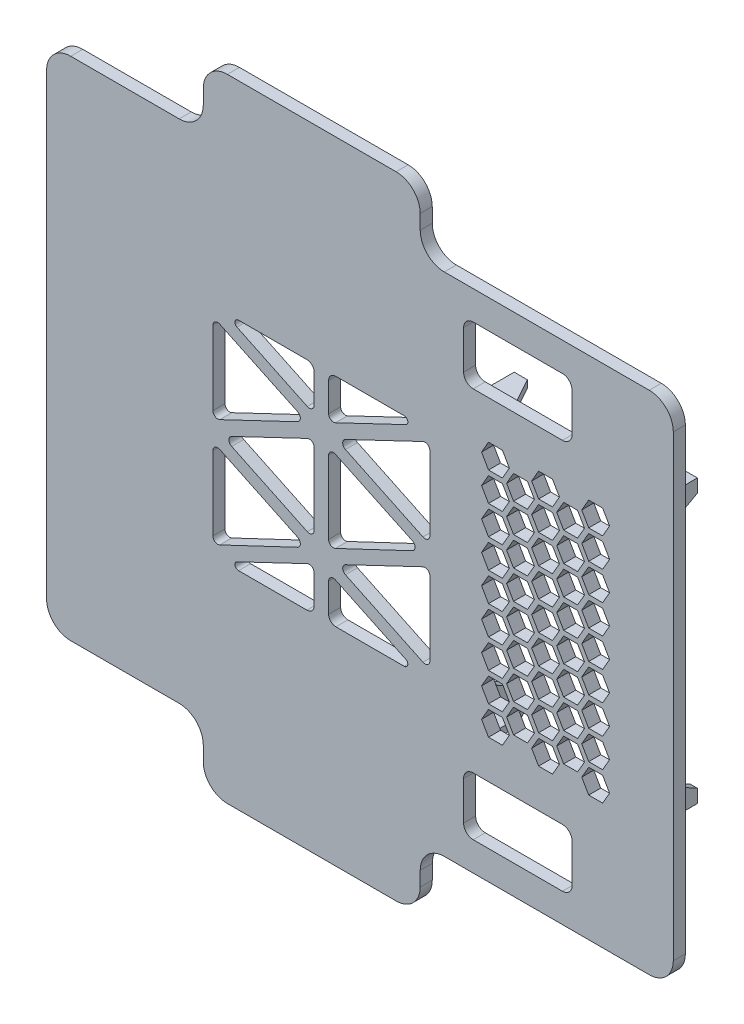
from build123d import *

# Parameters (mm, degrees)
EXTRUDE_1_DEPTH       = 5
EXTRUDE_2_DEPTH       = 20
CUT_EXTRUDE_3_DEPTH   = 10
CUT_EXTRUDE_4_DEPTH   = 10
MIRROR_2_COPY_1_DEPTH = 20
MIRROR_2_COPY_2_DEPTH = 10
MIRROR_2_COPY_3_DEPTH = 10
MIRROR_2_COPY_4_DEPTH = 20
MIRROR_2_COPY_5_DEPTH = 10
MIRROR_2_COPY_6_DEPTH = 10
CUT_EXTRUDE_5_DEPTH   = 5
SKETCH_9_W            = 45
SKETCH_9_H            = 24
CUT_EXTRUDE_6_DEPTH   = 5
FILLET_1_R            = 4
FILLET_2_R            = 1.5
FILLET_3_R            = 2
FILLET_4_R            = 3


with BuildPart() as part:
    # 草图1 → 凸台-拉伸1 (new body)
    with BuildSketch(Plane.XY):
        with BuildLine():
            Line((-130, 95), (-130, -95))
            ThreePointArc((-130, -95), (-127.071067812, -102.071067812), (-120, -105))
            Line((-120, -105), (-75, -105))
            ThreePointArc((-75, -105), (-67.928932188, -107.928932188), (-65, -115))
            Line((-65, -115), (-65, -121))
            ThreePointArc((-65, -121), (-62.071067812, -128.071067812), (-55, -131))
            Line((-55, -131), (15, -131))
            ThreePointArc((15, -131), (22.071067812, -128.071067812), (25, -121))
            Line((25, -121), (25, -115))
            ThreePointArc((25, -115), (27.928932188, -107.928932188), (35, -105))
            Line((35, -105), (120, -105))
            ThreePointArc((120, -105), (127.071067812, -102.071067812), (130, -95))
            Line((130, -95), (130, 95))
            ThreePointArc((130, 95), (127.071067812, 102.071067812), (120, 105))
            Line((120, 105), (35, 105))
            ThreePointArc((35, 105), (27.928932188, 107.928932188), (25, 115))
            Line((25, 115), (25, 121))
            ThreePointArc((25, 121), (22.071067812, 128.071067812), (15, 131))
            Line((15, 131), (-55, 131))
            ThreePointArc((-55, 131), (-62.071067812, 128.071067812), (-65, 121))
            Line((-65, 121), (-65, 115))
            ThreePointArc((-65, 115), (-67.928932188, 107.928932188), (-75, 105))
            Line((-75, 105), (-120, 105))
            ThreePointArc((-120, 105), (-127.071067812, 102.071067812), (-130, 95))
        make_face()
    extrude(amount=EXTRUDE_1_DEPTH)

    # 草图4 → 凸台-拉伸2 (add)
    with BuildSketch(Plane(origin=(0, 0, 0), x_dir=(-1, 0, 0), z_dir=(0, 0, -1))):
        Polygon((-39, -47.5), (-39, -58.5), (-50, -58.5), (-50, -55.5), (-42, -55.5), (-42, -47.5), align=None)
    extrude_2 = extrude(amount=EXTRUDE_2_DEPTH)

    # 草图5 → 切除-拉伸3 (cut)
    with BuildSketch(Plane.XZ.offset(58.5)):
        Polygon((50, -10), (44.5, -20), (50, -20), align=None)
    cut_extrude_3 = extrude(amount=-CUT_EXTRUDE_3_DEPTH, mode=Mode.SUBTRACT)

    # 草图6 → 切除-拉伸4 (cut)
    with BuildSketch(Plane.ZY.offset(-39)):
        Polygon((-20, -53), (-10, -47.5), (-20, -47.5), align=None)
    cut_extrude_4 = extrude(amount=-CUT_EXTRUDE_4_DEPTH, mode=Mode.SUBTRACT)

    # 镜向1: 凸台-拉伸2, 切除-拉伸3, 切除-拉伸4 across plane
    add(extrude_2.mirror(Plane(origin=(77, 0, 0), x_dir=(0, 0, 1), z_dir=(1, 0, 0))))
    add(cut_extrude_3.mirror(Plane(origin=(77, 0, 0), x_dir=(0, 0, 1), z_dir=(1, 0, 0))), mode=Mode.SUBTRACT)
    add(cut_extrude_4.mirror(Plane(origin=(77, 0, 0), x_dir=(0, 0, 1), z_dir=(1, 0, 0))), mode=Mode.SUBTRACT)

    # 镜向2 copy 1 sketch → 镜向2 copy 1 (add)
    with BuildSketch(Plane(origin=(154, 0, 0), x_dir=(1, 0, 0), z_dir=(0, 0, -1))):
        Polygon((-39, -47.5), (-39, -58.5), (-50, -58.5), (-50, -55.5), (-42, -55.5), (-42, -47.5), align=None)
    extrude(amount=MIRROR_2_COPY_1_DEPTH)

    # 镜向2 copy 2 sketch → 镜向2 copy 2 (cut)
    with BuildSketch(Plane(origin=(154, 58.5, 0), x_dir=(-1, 0, 0), z_dir=(0, 1, 0))):
        Polygon((50, -10), (44.5, -20), (50, -20), align=None)
    extrude(amount=-MIRROR_2_COPY_2_DEPTH, mode=Mode.SUBTRACT)

    # 镜向2 copy 3 sketch → 镜向2 copy 3 (cut)
    with BuildSketch(Plane(origin=(115, 0, 0), x_dir=(0, 0, 1), z_dir=(1, 0, 0))):
        Polygon((-20, -53), (-10, -47.5), (-20, -47.5), align=None)
    extrude(amount=-MIRROR_2_COPY_3_DEPTH, mode=Mode.SUBTRACT)

    # 镜向2 copy 4 sketch → 镜向2 copy 4 (add)
    with BuildSketch(Plane(origin=(0, 0, 0), x_dir=(-1, 0, 0), z_dir=(0, 0, -1))):
        Polygon((-39, 47.5), (-39, 58.5), (-50, 58.5), (-50, 55.5), (-42, 55.5), (-42, 47.5), align=None)
    extrude(amount=MIRROR_2_COPY_4_DEPTH)

    # 镜向2 copy 5 sketch → 镜向2 copy 5 (cut)
    with BuildSketch(Plane(origin=(0, 58.5, 0), x_dir=(1, 0, 0), z_dir=(0, 1, 0))):
        Polygon((50, 10), (44.5, 20), (50, 20), align=None)
    extrude(amount=-MIRROR_2_COPY_5_DEPTH, mode=Mode.SUBTRACT)

    # 镜向2 copy 6 sketch → 镜向2 copy 6 (cut)
    with BuildSketch(Plane.ZY.offset(-39)):
        Polygon((-20, 53), (-10, 47.5), (-20, 47.5), align=None)
    extrude(amount=-MIRROR_2_COPY_6_DEPTH, mode=Mode.SUBTRACT)

    # 草图7 → 切除-拉伸5 (cut)
    with BuildSketch(Plane(origin=(0, 0, 0), x_dir=(-1, 0, 0), z_dir=(0, 0, -1))):
        Polygon((-92.012994616, 36), (-94.899745962, 41), (-100.673248654, 41), (-103.56, 36), (-100.673248654, 31), (-94.899745962, 31), align=None)
        Polygon((-74.115136271, 31), (-71.228384925, 36), (-74.115136271, 41), (-79.888638963, 41), (-82.775390309, 36), (-79.888638963, 31), align=None)
        Polygon((-92.012994616, 24), (-94.899745962, 29), (-100.673248654, 29), (-103.56, 24), (-100.673248654, 19), (-94.899745962, 19), align=None)
        Polygon((-93.167695155, 30), (-90.280943809, 25), (-84.507441117, 25), (-81.620689771, 30), (-84.507441117, 35), (-90.280943809, 35), align=None)
        Polygon((-84.507441117, 37), (-81.620689771, 42), (-84.507441117, 47), (-90.280943809, 47), (-93.167695155, 42), (-90.280943809, 37), align=None)
        Polygon((-79.888638963, 43), (-74.115136271, 43), (-71.228384925, 48), (-74.115136271, 53), (-79.888638963, 53), (-82.775390309, 48), align=None)
        Polygon((-94.899745962, 43), (-92.012994616, 48), (-94.899745962, 53), (-100.673248654, 53), (-103.56, 48), (-100.673248654, 43), align=None)
        Polygon((-72.383085464, 42), (-69.496334118, 37), (-63.722831426, 37), (-60.83608008, 42), (-63.722831426, 47), (-69.496334118, 47), align=None)
        Polygon((-93.167695155, 18), (-90.280943809, 13), (-84.507441117, 13), (-81.620689771, 18), (-84.507441117, 23), (-90.280943809, 23), align=None)
        Polygon((-74.115136271, 19), (-71.228384925, 24), (-74.115136271, 29), (-79.888638963, 29), (-82.775390309, 24), (-79.888638963, 19), align=None)
        Polygon((-72.383085464, 30), (-69.496334118, 25), (-63.722831426, 25), (-60.83608008, 30), (-63.722831426, 35), (-69.496334118, 35), align=None)
        Polygon((-92.012994616, 12), (-94.899745962, 17), (-100.673248654, 17), (-103.56, 12), (-100.673248654, 7), (-94.899745962, 7), align=None)
        Polygon((-93.167695155, 6), (-90.280943809, 1), (-84.507441117, 1), (-81.620689771, 6), (-84.507441117, 11), (-90.280943809, 11), align=None)
        Polygon((-74.115136271, 7), (-71.228384925, 12), (-74.115136271, 17), (-79.888638963, 17), (-82.775390309, 12), (-79.888638963, 7), align=None)
        Polygon((-72.383085464, 18), (-69.496334118, 13), (-63.722831426, 13), (-60.83608008, 18), (-63.722831426, 23), (-69.496334118, 23), align=None)
        Polygon((-92.012994616, 0), (-94.899745962, 5), (-100.673248654, 5), (-103.56, 0), (-100.673248654, -5), (-94.899745962, -5), align=None)
        Polygon((-93.167695155, -6), (-90.280943809, -11), (-84.507441117, -11), (-81.620689771, -6), (-84.507441117, -1), (-90.280943809, -1), align=None)
        Polygon((-74.115136271, -5), (-71.228384925, 0), (-74.115136271, 5), (-79.888638963, 5), (-82.775390309, 0), (-79.888638963, -5), align=None)
        Polygon((-72.383085464, 6), (-69.496334118, 1), (-63.722831426, 1), (-60.83608008, 6), (-63.722831426, 11), (-69.496334118, 11), align=None)
        Polygon((-92.012994616, -12), (-94.899745962, -7), (-100.673248654, -7), (-103.56, -12), (-100.673248654, -17), (-94.899745962, -17), align=None)
        Polygon((-93.167695155, -18), (-90.280943809, -23), (-84.507441117, -23), (-81.620689771, -18), (-84.507441117, -13), (-90.280943809, -13), align=None)
        Polygon((-74.115136271, -17), (-71.228384925, -12), (-74.115136271, -7), (-79.888638963, -7), (-82.775390309, -12), (-79.888638963, -17), align=None)
        Polygon((-72.383085464, -6), (-69.496334118, -11), (-63.722831426, -11), (-60.83608008, -6), (-63.722831426, -1), (-69.496334118, -1), align=None)
        Polygon((-92.012994616, -24), (-94.899745962, -19), (-100.673248654, -19), (-103.56, -24), (-100.673248654, -29), (-94.899745962, -29), align=None)
        Polygon((-93.167695155, -30), (-90.280943809, -35), (-84.507441117, -35), (-81.620689771, -30), (-84.507441117, -25), (-90.280943809, -25), align=None)
        Polygon((-74.115136271, -29), (-71.228384925, -24), (-74.115136271, -19), (-79.888638963, -19), (-82.775390309, -24), (-79.888638963, -29), align=None)
        Polygon((-72.383085464, -18), (-69.496334118, -23), (-63.722831426, -23), (-60.83608008, -18), (-63.722831426, -13), (-69.496334118, -13), align=None)
        Polygon((-92.012994616, -36), (-94.899745962, -31), (-100.673248654, -31), (-103.56, -36), (-100.673248654, -41), (-94.899745962, -41), align=None)
        Polygon((-93.167695155, -42), (-90.280943809, -47), (-84.507441117, -47), (-81.620689771, -42), (-84.507441117, -37), (-90.280943809, -37), align=None)
        Polygon((-74.115136271, -41), (-71.228384925, -36), (-74.115136271, -31), (-79.888638963, -31), (-82.775390309, -36), (-79.888638963, -41), align=None)
        Polygon((-72.383085464, -30), (-69.496334118, -35), (-63.722831426, -35), (-60.83608008, -30), (-63.722831426, -25), (-69.496334118, -25), align=None)
        Polygon((-92.012994616, -48), (-94.899745962, -43), (-100.673248654, -43), (-103.56, -48), (-100.673248654, -53), (-94.899745962, -53), align=None)
        Polygon((-74.115136271, -53), (-71.228384925, -48), (-74.115136271, -43), (-79.888638963, -43), (-82.775390309, -48), (-79.888638963, -53), align=None)
        Polygon((-72.383085464, -42), (-69.496334118, -47), (-63.722831426, -47), (-60.83608008, -42), (-63.722831426, -37), (-69.496334118, -37), align=None)
        Polygon((-61.990780618, 36), (-59.104029272, 31), (-53.330526581, 31), (-50.443775235, 36), (-53.330526581, 41), (-59.104029272, 41), align=None)
        Polygon((-61.990780618, 48), (-59.104029272, 43), (-53.330526581, 43), (-50.443775235, 48), (-53.330526581, 53), (-59.104029272, 53), align=None)
        Polygon((-61.990780618, 24), (-59.104029272, 19), (-53.330526581, 19), (-50.443775235, 24), (-53.330526581, 29), (-59.104029272, 29), align=None)
        Polygon((-61.990780618, 12), (-59.104029272, 7), (-53.330526581, 7), (-50.443775235, 12), (-53.330526581, 17), (-59.104029272, 17), align=None)
        Polygon((-61.990780618, 0), (-59.104029272, -5), (-53.330526581, -5), (-50.443775235, 0), (-53.330526581, 5), (-59.104029272, 5), align=None)
        Polygon((-61.990780618, -12), (-59.104029272, -17), (-53.330526581, -17), (-50.443775235, -12), (-53.330526581, -7), (-59.104029272, -7), align=None)
        Polygon((-61.990780618, -24), (-59.104029272, -29), (-53.330526581, -29), (-50.443775235, -24), (-53.330526581, -19), (-59.104029272, -19), align=None)
        Polygon((-61.990780618, -36), (-59.104029272, -41), (-53.330526581, -41), (-50.443775235, -36), (-53.330526581, -31), (-59.104029272, -31), align=None)
        Polygon((-61.990780618, -48), (-59.104029272, -53), (-53.330526581, -53), (-50.443775235, -48), (-53.330526581, -43), (-59.104029272, -43), align=None)
    extrude(amount=-CUT_EXTRUDE_5_DEPTH, mode=Mode.SUBTRACT)

    # 草图9 → 切除-拉伸6 (cut)
    with BuildSketch(Plane(origin=(0, 0, 0), x_dir=(-1, 0, 0), z_dir=(0, 0, -1))):
        Polygon((9.804878049, 22.5), (-29, 41), (-29, 4), align=None)
        Polygon((13, -26.88372093), (-25, -45), (13, -45), align=None)
        Polygon((22.074593576, -22.557461202), (61, -41), (61, -4), align=None)
        Polygon((19, 26.88372093), (57, 45), (19, 45), align=None)
        Polygon((19, -18.11627907), (57, 0), (19, 18.11627907), align=None)
        with Locations((-65.5, 81)):
            Rectangle(SKETCH_9_W, SKETCH_9_H)
        with Locations((-65.5, -81)):
            Rectangle(SKETCH_9_W, SKETCH_9_H)
        Polygon((13, 45), (-25, 45), (13, 26.88372093), align=None)
        Polygon((61, 4), (61, 41), (22.074593576, 22.557461202), align=None)
        Polygon((13, 18.257993079), (-25.535898385, 0), (13, -18.257993079), align=None)
        Polygon((19, -45), (57, -45), (19, -26.88372093), align=None)
        Polygon((-29, -41), (9.804878049, -22.5), (-29, -4), align=None)
    extrude(amount=-CUT_EXTRUDE_6_DEPTH, mode=Mode.SUBTRACT)

    # 圆角1
    fillet_1_edges = [part.edges().sort_by_distance(p)[0] for p in [
        (43, -93, 2.5),
        (88, -69, 2.5),
        (43, -69, 2.5),
        (88, -93, 2.5),
        (88, 69, 2.5),
        (43, 69, 2.5),
        (43, 93, 2.5),
        (88, 93, 2.5),
    ]]
    fillet(fillet_1_edges, radius=FILLET_1_R)

    # 圆角2
    fillet_2_edges = [part.edges().sort_by_distance(p)[0] for p in [
        (25, -45, 2.5),
        (-57, -45, 2.5),
        (25, 45, 2.5),
        (-57, 45, 2.5),
    ]]
    fillet(fillet_2_edges, radius=FILLET_2_R)

    # 圆角3
    fillet_3_edges = [part.edges().sort_by_distance(p)[0] for p in [
        (29, -4, 2.5),
        (29, 4, 2.5),
        (-13, -18.257993079, 2.5),
        (-61, -41, 2.5),
        (-61, 4, 2.5),
        (-13, -26.88372093, 2.5),
        (-13, 18.257993079, 2.5),
        (-61, -4, 2.5),
        (-22.074593576, -22.557461202, 2.5),
        (25.535898385, 0, 2.5),
        (-22.074593576, 22.557461202, 2.5),
        (-61, 41, 2.5),
        (-19, 26.88372093, 2.5),
        (-19, -26.88372093, 2.5),
        (-19, -18.11627907, 2.5),
        (29, -41, 2.5),
        (29, 41, 2.5),
        (-57, 0, 2.5),
        (-9.804878049, -22.5, 2.5),
        (-13, 26.88372093, 2.5),
        (-9.804878049, 22.5, 2.5),
        (-19, 18.11627907, 2.5),
    ]]
    fillet(fillet_3_edges, radius=FILLET_3_R)

    # 圆角4
    fillet_4_edges = [part.edges().sort_by_distance(p)[0] for p in [
        (-13, -45, 2.5),
        (-13, 45, 2.5),
        (-19, -45, 2.5),
        (-19, 45, 2.5),
    ]]
    fillet(fillet_4_edges, radius=FILLET_4_R)


solid = part.part
